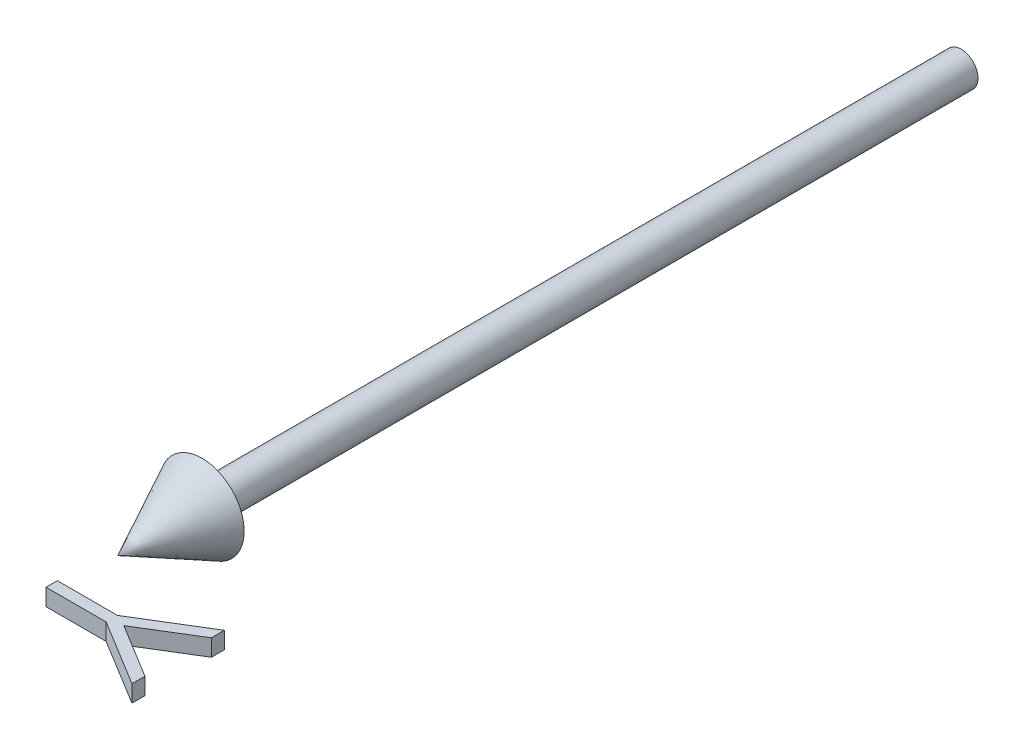
from build123d import *

# Parameters (mm, degrees)
BOSS_EXTRUDE1_DEPTH      = 1
BOSS_EXTRUDE1_DEPTH_BACK = 1


with BuildPart() as part:
    # Sketch2 → Revolve1 (revolve)
    with BuildSketch(Plane(origin=(0, 0, 0), x_dir=(1, 0, 0), z_dir=(0, 1, 0))):
        Polygon((0, -100), (5, -90), (2, -90), (2, 0), (0, 0), align=None)
    revolve(axis=Axis((0, 0, -41.949952025), (0, 0, 1)))


with BuildPart() as body_2:
    # Sketch3 → Boss-Extrude1 (new, two sides: drawn at the far end of the back side and taken through both)
    with BuildSketch(Plane(origin=(0, 0, 0), x_dir=(1, 0, 0), z_dir=(0, 1, 0)).offset(-BOSS_EXTRUDE1_DEPTH_BACK)):
        Polygon((15, -102.339799406), (15, -103.881265752), (8.5546875, -107.823573444), (15, -111.759871521), (15, -113.301337867), (7.130408654, -108.49364556), (0, -108.49364556), (0, -107.147491713), (7.130408654, -107.147491713), align=None)
    extrude(amount=BOSS_EXTRUDE1_DEPTH + BOSS_EXTRUDE1_DEPTH_BACK)


solid = Compound([part.part, body_2.part])
